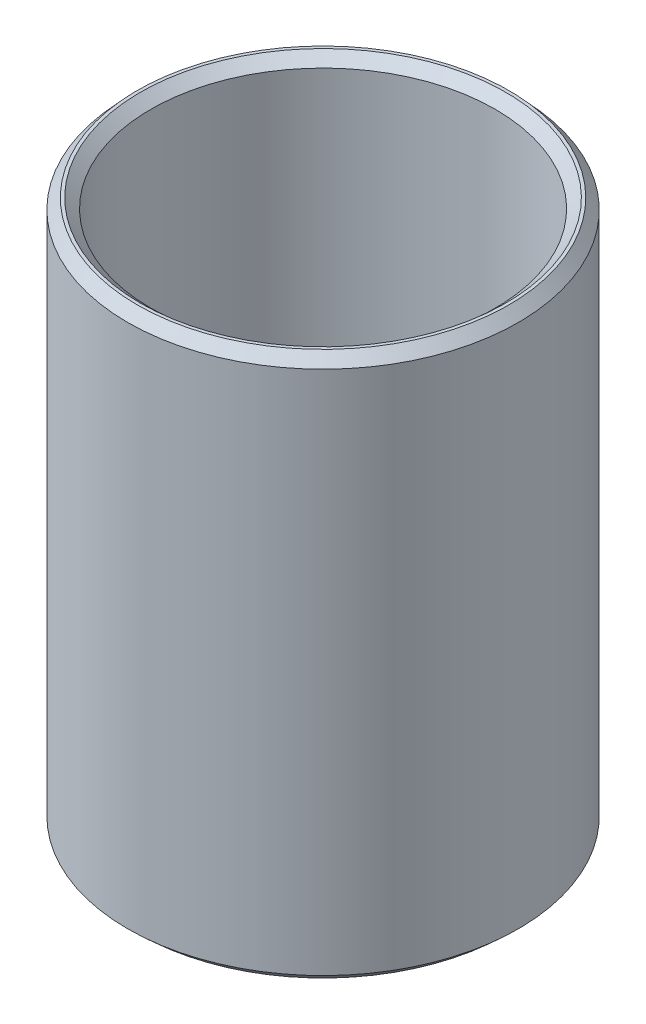
from build123d import *
from OCP.BRepFilletAPI import BRepFilletAPI_MakeChamfer

# Parameters (mm, degrees)
SKETCH1_R           = 57.5
BOSS_EXTRUDE1_DEPTH = 160.480718189
SKETCH2_R           = 50.705045147
CUT_EXTRUDE1_DEPTH  = 180.907089662
CHAMFER1_SIZE       = 3.076345241
CHAMFER1_SIZE2      = 2.805262106


with BuildPart() as part:
    # Sketch1 → Boss-Extrude1 (new body)
    with BuildSketch(Plane(origin=(0, 0, 0), x_dir=(1, 0, 0), z_dir=(0, 1, 0))):
        Circle(SKETCH1_R)
    extrude(amount=BOSS_EXTRUDE1_DEPTH)

    # Sketch2 → Cut-Extrude1 (cut, through all)
    with BuildSketch(Plane(origin=(0, 0, 0), x_dir=(1, 0, 0), z_dir=(0, 1, 0))):
        Circle(SKETCH2_R)
    extrude(amount=CUT_EXTRUDE1_DEPTH, mode=Mode.SUBTRACT)

    # Chamfer1: one chamfer whose edges measure the first distance from different faces: ONE call of the kernel's chamfer builder (chamfer() names one face for all edges)
    chamfer1_edges_1 = [part.edges().sort_by_distance(p)[0] for p in [
        (-50.705045147, 160.480718189, 0),
    ]]
    chamfer1_side_1 = [part.faces().sort_by_distance(p)[0] for p in [
        (-55.873654403, 160.480718189, 0),
    ]]
    chamfer1_edges_2 = [part.edges().sort_by_distance(p)[0] for p in [
        (-50.705045147, 0, 0),
    ]]
    chamfer1_side_2 = [part.faces().sort_by_distance(p)[0] for p in [
        (-50.705045147, 80.240359095, 0),
    ]]
    chamfer1_edges_3 = [part.edges().sort_by_distance(p)[0] for p in [
        (-57.5, 0, 0),
    ]]
    chamfer1_side_3 = [part.faces().sort_by_distance(p)[0] for p in [
        (-55.873654403, 0, 0),
    ]]
    chamfer1_edges_4 = [part.edges().sort_by_distance(p)[0] for p in [
        (-57.5, 160.480718189, 0),
    ]]
    chamfer1_side_4 = [part.faces().sort_by_distance(p)[0] for p in [
        (-57.5, 80.240359095, 0),
    ]]
    chamfer1 = BRepFilletAPI_MakeChamfer(part.part.solid().wrapped)
    for e in chamfer1_edges_1:
        chamfer1.Add(CHAMFER1_SIZE, CHAMFER1_SIZE2, e.wrapped, chamfer1_side_1[0].wrapped)  # the first distance lies on this face
    for e in chamfer1_edges_2:
        chamfer1.Add(CHAMFER1_SIZE, CHAMFER1_SIZE2, e.wrapped, chamfer1_side_2[0].wrapped)  # the first distance lies on this face
    for e in chamfer1_edges_3:
        chamfer1.Add(CHAMFER1_SIZE, CHAMFER1_SIZE2, e.wrapped, chamfer1_side_3[0].wrapped)  # the first distance lies on this face
    for e in chamfer1_edges_4:
        chamfer1.Add(CHAMFER1_SIZE, CHAMFER1_SIZE2, e.wrapped, chamfer1_side_4[0].wrapped)  # the first distance lies on this face
    add(Compound.cast(chamfer1.Shape()), mode=Mode.REPLACE)


solid = part.part
